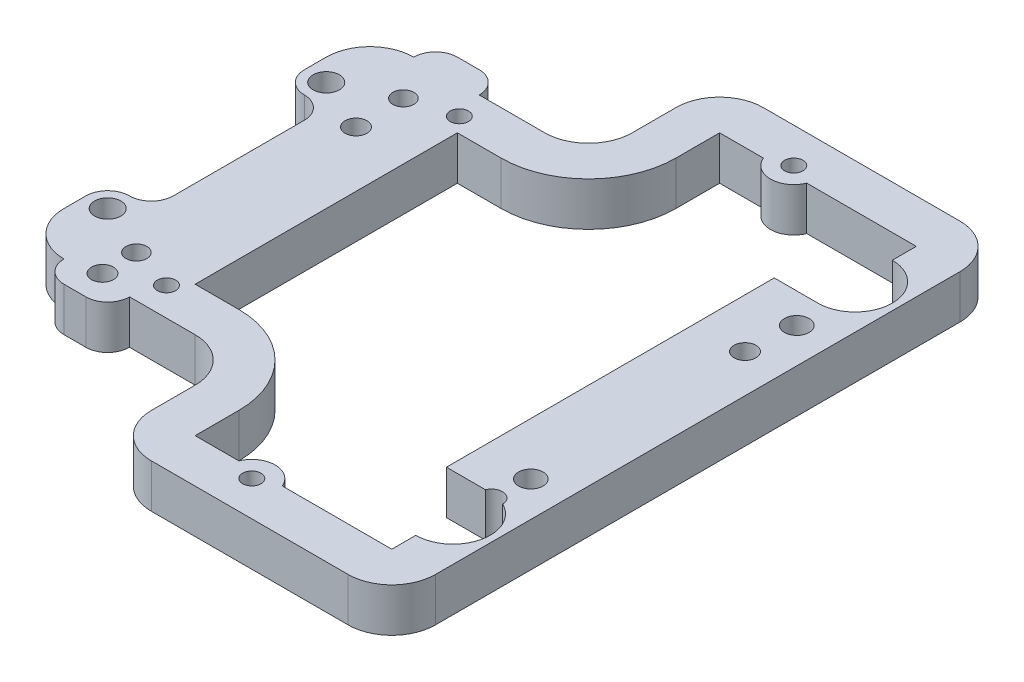
from build123d import *

# Parameters (mm, degrees)
BOSS_EXTRUDE1_DEPTH = 10
FILLET1_R           = 10
FILLET2_R           = 10
FILLET3_R           = 10
CUT_EXTRUDE1_DEPTH  = 10
CUT_EXTRUDE2_DEPTH  = 10
SKETCH5_R           = 5.34535751
BOSS_EXTRUDE2_DEPTH = 10
SKETCH7_R           = 2.1
CUT_EXTRUDE3_DEPTH  = 10
SKETCH13_R          = 2.1
CUT_EXTRUDE4_DEPTH  = 10
SKETCH15_W          = 75
SKETCH15_H          = 10
BOSS_EXTRUDE3_DEPTH = 10
SKETCH18_W          = 60
SKETCH18_H          = 10
BOSS_EXTRUDE4_DEPTH = 10
SKETCH19_R          = 2.4
SKETCH19_R_2        = 2.8
CUT_EXTRUDE6_DEPTH  = 10
SKETCH20_W          = 80
SKETCH20_H          = 10
BOSS_EXTRUDE5_DEPTH = 10
CUT_EXTRUDE7_DEPTH  = 10
FILLET4_R           = 10
SKETCH22_W          = 10
SKETCH22_H          = 20
CUT_EXTRUDE8_DEPTH  = 10
FILLET5_START       = -1
FILLET5_DEPTH       = 12
FILLET5_2_DEPTH     = 10
SKETCH24_W          = 15
SKETCH24_H          = 10
BOSS_EXTRUDE6_DEPTH = 5
SKETCH25_W          = 15
SKETCH25_H          = 10
BOSS_EXTRUDE7_DEPTH = 5
SKETCH26_R          = 2.5
CUT_EXTRUDE9_DEPTH  = 15
FILLET6_R           = 5


with BuildPart() as part:
    # Sketch1 → Boss-Extrude1 (new body)
    with BuildSketch(Plane(origin=(0, 0, 0), x_dir=(1, 0, 0), z_dir=(0, 1, 0))):
        Polygon((-52.5, 37.850859258), (-12.5, 37.850859258), (-12.5, 67.850859258), (52.5, 67.850859258), (52.5, -72.149140742), (-12.5, -72.149140742), (-12.5, -42.149140742), (-52.5, -42.149140742), align=None)
    extrude(amount=BOSS_EXTRUDE1_DEPTH)

    # Fillet1
    fillet1_edges = [part.edges().sort_by_distance(p)[0] for p in [
        (-12.5, 5, 42.149140742),
        (-12.5, 5, -37.850859258),
    ]]
    fillet(fillet1_edges, radius=FILLET1_R)

    # Fillet2
    fillet2_edges = [part.edges().sort_by_distance(p)[0] for p in [
        (-12.5, 5, 72.149140742),
        (-12.5, 5, -67.850859258),
    ]]
    fillet(fillet2_edges, radius=FILLET2_R)

    # Fillet3
    fillet3_edges = [part.edges().sort_by_distance(p)[0] for p in [
        (52.5, 5, 72.149140742),
        (52.5, 5, -67.850859258),
    ]]
    fillet(fillet3_edges, radius=FILLET3_R)

    # Sketch3 → Cut-Extrude1 (cut)
    with BuildSketch(Plane(origin=(0, 10, 0), x_dir=(1, 0, 0), z_dir=(0, 1, 0))):
        with BuildLine():
            ThreePointArc((51, 43.850859258), (48.51040764, 49.861266898), (42.5, 52.350859258))
            Line((42.5, 52.350859258), (42.5, 35.350859258))
            ThreePointArc((42.5, 35.350859258), (48.51040764, 37.840451618), (51, 43.850859258))
        make_face()
        with BuildLine():
            Line((42.5, 35.350859258), (42.5, 52.350859258))
            ThreePointArc((42.5, 52.350859258), (34, 43.850859258), (42.5, 35.350859258))
        make_face()
        with BuildLine():
            ThreePointArc((51, -48.149140742), (48.51040764, -42.138733102), (42.5, -39.649140742))
            Line((42.5, -39.649140742), (42.5, -56.649140742))
            ThreePointArc((42.5, -56.649140742), (48.51040764, -54.159548382), (51, -48.149140742))
        make_face()
        with BuildLine():
            Line((42.5, -56.649140742), (42.5, -39.649140742))
            ThreePointArc((42.5, -39.649140742), (34, -48.149140742), (42.5, -56.649140742))
        make_face()
    extrude(amount=-CUT_EXTRUDE1_DEPTH, mode=Mode.SUBTRACT)

    # Sketch4 → Cut-Extrude2 (cut)
    with BuildSketch(Plane(origin=(0, 10, 0), x_dir=(1, 0, 0), z_dir=(0, 1, 0))):
        with BuildLine():
            Line((-2.5, -62.149140742), (42.5, -62.149140742))
            Line((42.5, -62.149140742), (42.5, 57.850859258))
            Line((42.5, 57.850859258), (-2.5, 57.850859258))
            Line((-2.5, 57.850859258), (-2.5, 47.850859258))
            ThreePointArc((-2.5, 47.850859258), (-8.357864376, 33.708723634), (-22.5, 27.850859258))
            Line((-22.5, 27.850859258), (-42.5, 27.850859258))
            Line((-42.5, 27.850859258), (-42.5, -32.149140742))
            Line((-42.5, -32.149140742), (-22.5, -32.149140742))
            ThreePointArc((-22.5, -32.149140742), (-8.357864376, -38.007005118), (-2.5, -52.149140742))
            Line((-2.5, -52.149140742), (-2.5, -62.149140742))
        make_face()
    extrude(amount=-CUT_EXTRUDE2_DEPTH, mode=Mode.SUBTRACT)

    # Sketch5 → Boss-Extrude2 (add)
    with BuildSketch(Plane(origin=(0, 10, 0), x_dir=(1, 0, 0), z_dir=(0, 1, 0))):
        with Locations((12.473028737, 59.850859258)):
            Circle(SKETCH5_R)
        with Locations((12.473028737, -64.149140742)):
            Circle(SKETCH5_R)
    extrude(amount=-BOSS_EXTRUDE2_DEPTH)

    # Sketch7 → Cut-Extrude3 (cut)
    with BuildSketch(Plane(origin=(0, 10, 0), x_dir=(1, 0, 0), z_dir=(0, 1, 0))):
        with Locations(Location((12.473028737, 59.850859258, 0), (0, 0, 270))):
            Circle(SKETCH7_R)
        with Locations(Location((12.473028737, -64.149140742, 0), (0, 0, 270))):
            Circle(SKETCH7_R)
    extrude(amount=-CUT_EXTRUDE3_DEPTH, mode=Mode.SUBTRACT)

    # Sketch13 → Cut-Extrude4 (cut)
    with BuildSketch(Plane(origin=(0, 10, 0), x_dir=(1, 0, 0), z_dir=(0, 1, 0))):
        with Locations(Location((-35.553942525, -35.649140742, 0), (0, 0, 270))):
            Circle(SKETCH13_R)
        with Locations(Location((-35.553942525, 31.350859258, 0), (0, 0, 270))):
            Circle(SKETCH13_R)
    extrude(amount=-CUT_EXTRUDE4_DEPTH, mode=Mode.SUBTRACT)

    # Sketch15 → Boss-Extrude3 (add)
    with BuildSketch(Plane.ZY.offset(-42.5)):
        with Locations((2.149140742, 5)):
            Rectangle(SKETCH15_W, SKETCH15_H)
    extrude(amount=BOSS_EXTRUDE3_DEPTH)

    # Sketch18 → Boss-Extrude4 (add)
    with BuildSketch(Plane(origin=(-42.5, 0, 0), x_dir=(0, 0, -1), z_dir=(1, 0, 0))):
        with Locations((-2.149140742, 5)):
            Rectangle(SKETCH18_W, SKETCH18_H)
    extrude(amount=BOSS_EXTRUDE4_DEPTH)

    # Sketch19 → Cut-Extrude6 (cut)
    with BuildSketch(Plane(origin=(0, 10, 0), x_dir=(1, 0, 0), z_dir=(0, 1, 0))):
        with Locations(Location((-45.5, 28.502344732, 0), (0, 0, 270))):
            Circle(SKETCH19_R)
        with Locations(Location((-45.5, -32.57798884, 0), (0, 0, 270))):
            Circle(SKETCH19_R)
        with Locations(Location((44.5, -32.342002638, 0), (0, 0, 270))):
            Circle(SKETCH19_R_2)
        with Locations(Location((44.5, 28.502344732, 0), (0, 0, 270))):
            Circle(SKETCH19_R_2)
    extrude(amount=-CUT_EXTRUDE6_DEPTH, mode=Mode.SUBTRACT)

    # Sketch20 → Boss-Extrude5 (add)
    with BuildSketch(Plane.ZY.offset(52.5)):
        with Locations((2.149140742, 5)):
            Rectangle(SKETCH20_W, SKETCH20_H)
    extrude(amount=BOSS_EXTRUDE5_DEPTH)

    # Sketch21 → Cut-Extrude7 (cut)
    with BuildSketch(Plane(origin=(0, 10, 0), x_dir=(1, 0, 0), z_dir=(0, 1, 0))):
        with BuildLine():
            ThreePointArc((-54.5, 22.850859258), (-55.378679656, 24.972179602), (-57.5, 25.850859258))
            Line((-57.5, 25.850859258), (-57.5, 19.850859258))
            ThreePointArc((-57.5, 19.850859258), (-55.378679656, 20.729538915), (-54.5, 22.850859258))
        make_face()
        with BuildLine():
            Line((-57.5, 19.850859258), (-57.5, 25.850859258))
            ThreePointArc((-57.5, 25.850859258), (-60.5, 22.850859258), (-57.5, 19.850859258))
        make_face()
        with BuildLine():
            ThreePointArc((-54.5, -27.149140742), (-55.378679656, -25.027820398), (-57.5, -24.149140742))
            Line((-57.5, -24.149140742), (-57.5, -30.149140742))
            ThreePointArc((-57.5, -30.149140742), (-55.378679656, -29.270461085), (-54.5, -27.149140742))
        make_face()
        with BuildLine():
            Line((-57.5, -30.149140742), (-57.5, -24.149140742))
            ThreePointArc((-57.5, -24.149140742), (-60.5, -27.149140742), (-57.5, -30.149140742))
        make_face()
    extrude(amount=-CUT_EXTRUDE7_DEPTH, mode=Mode.SUBTRACT)

    # Fillet4
    fillet4_edges = [part.edges().sort_by_distance(p)[0] for p in [
        (-62.5, 5, -37.850859258),
        (-62.5, 5, 42.149140742),
    ]]
    fillet(fillet4_edges, radius=FILLET4_R)

    # Sketch22 → Cut-Extrude8 (cut)
    with BuildSketch(Plane(origin=(0, 10, 0), x_dir=(1, 0, 0), z_dir=(0, 1, 0))):
        with Locations((-57.5, 7.850859258)):
            Rectangle(SKETCH22_W, SKETCH22_H)
        with Locations((-57.5, -12.149140742)):
            Rectangle(SKETCH22_W, SKETCH22_H)
    extrude(amount=-CUT_EXTRUDE8_DEPTH, mode=Mode.SUBTRACT)

    # Fillet5: read off the stored shape, not the designer's step
    # Fillet5 outline → Fillet5 (cut)
    with BuildSketch(Plane(origin=(0, 0, 0), x_dir=(1, 0, 0), z_dir=(0, 1, 0)).offset(FILLET5_START)):
        with BuildLine():
            Line((-62.5, 17.850859258), (-57.5, 17.850859258))
            ThreePointArc((-57.5, 17.850859258), (-61.035533906, 19.315325352), (-62.5, 22.850859258))
            Line((-62.5, 22.850859258), (-62.5, 17.850859258))
        make_face()
        with BuildLine():
            ThreePointArc((-62.5, -27.149140742), (-61.035533906, -23.613606836), (-57.5, -22.149140742))
            Line((-57.5, -22.149140742), (-62.5, -22.149140742))
            Line((-62.5, -22.149140742), (-62.5, -27.149140742))
        make_face()
    extrude(amount=FILLET5_DEPTH, mode=Mode.SUBTRACT)

    # Fillet5 2 outline → Fillet5 2 (add)
    with BuildSketch(Plane(origin=(0, 0, 0), x_dir=(1, 0, 0), z_dir=(0, 1, 0))):
        with BuildLine():
            Line((-52.5, 17.850859258), (-57.5, 17.850859258))
            ThreePointArc((-57.5, 17.850859258), (-53.964466094, 16.386393164), (-52.5, 12.850859258))
            Line((-52.5, 12.850859258), (-52.5, 17.850859258))
        make_face()
        with BuildLine():
            Line((-52.5, -22.149140742), (-52.5, -17.149140742))
            ThreePointArc((-52.5, -17.149140742), (-53.964466094, -20.684674648), (-57.5, -22.149140742))
            Line((-57.5, -22.149140742), (-52.5, -22.149140742))
        make_face()
    extrude(amount=FILLET5_2_DEPTH)

    # Sketch24 → Boss-Extrude6 (add)
    with BuildSketch(Plane.XY.offset(42.149140742)):
        with Locations((-45, 5)):
            Rectangle(SKETCH24_W, SKETCH24_H)
    extrude(amount=BOSS_EXTRUDE6_DEPTH)

    # Sketch25 → Boss-Extrude7 (add)
    with BuildSketch(Plane(origin=(0, 0, -37.850859258), x_dir=(-1, 0, 0), z_dir=(0, 0, -1))):
        with Locations((45, 5)):
            Rectangle(SKETCH25_W, SKETCH25_H)
    extrude(amount=BOSS_EXTRUDE7_DEPTH)

    # Sketch26 → Cut-Extrude9 (cut)
    with BuildSketch(Plane(origin=(0, 10, 0), x_dir=(1, 0, 0), z_dir=(0, 1, 0))):
        with Locations(Location((-45.25, 17.408381721, 0), (0, 0, 270))):
            Circle(SKETCH26_R)
        with Locations(Location((-45.25, -40.591618279, 0), (0, 0, 270))):
            Circle(SKETCH26_R)
        with Locations((43.75, -40.591618279)):
            Circle(SKETCH26_R)
        with Locations(Location((43.75, 17.408381721, 0), (0, 0, 270))):
            Circle(SKETCH26_R)
    extrude(amount=-CUT_EXTRUDE9_DEPTH, mode=Mode.SUBTRACT)

    # Fillet6
    fillet6_edges = [part.edges().sort_by_distance(p)[0] for p in [
        (-37.5, 5, 47.149140742),
        (-37.5, 5, -42.850859258),
        (-52.5, 5, -42.850859258),
        (-52.5, 5, 47.149140742),
    ]]
    fillet(fillet6_edges, radius=FILLET6_R - 0.0001)  # a hair under: the kernel refuses the full size


solid = part.part
